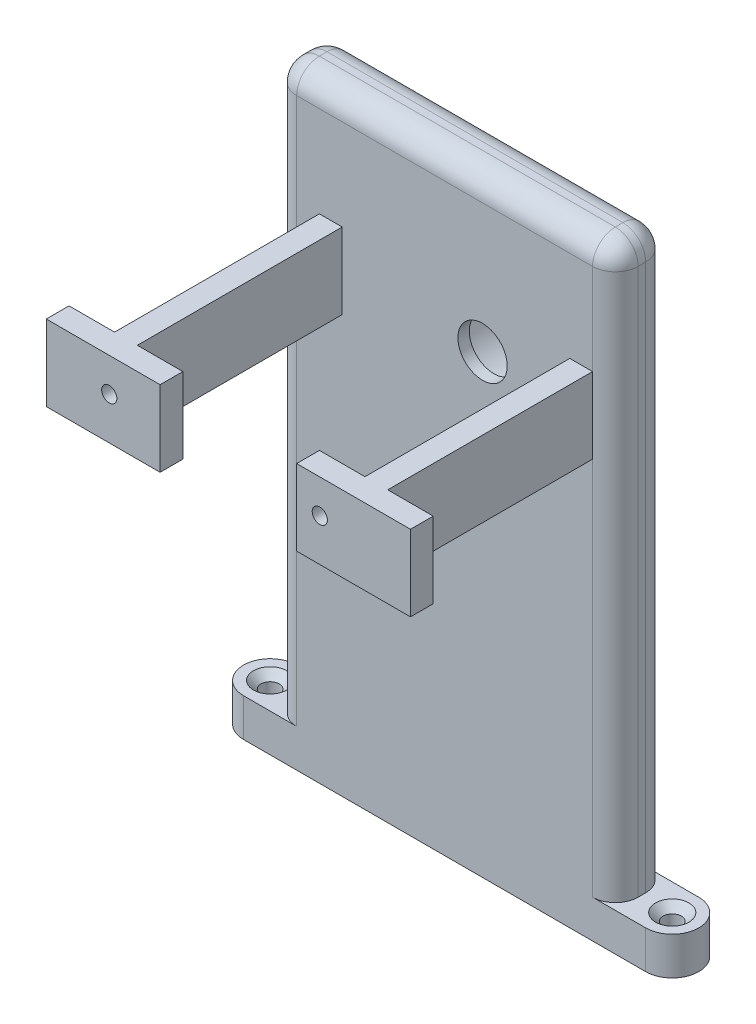
from build123d import *

# Parameters (mm, degrees)
CROQUIS1_W                   = 45
CROQUIS1_H                   = 80
CROQUIS1_R                   = 3.25
SALIENTE_EXTRUIR1_DEPTH      = 7
CROQUIS2_R                   = 6.5
CORTAR_EXTRUIR1_DEPTH        = 5
CROQUIS3_R                   = 6
CORTAR_EXTRUIR2_DEPTH        = 0.5
REDONDEO2_R                  = 3
SALIENTE_EXTRUIR2_DEPTH      = 5
TALADROAVANZADO1_OUTLINE_R   = 1.2
TALADROAVANZADO1_DEPTH       = 1
TALADROAVANZADO1_DRAFT       = -45
TALADROAVANZADO1_2_OUTLINE_R = 1.2
TALADROAVANZADO1_2_DEPTH     = 1
TALADROAVANZADO1_2_DRAFT     = -45
CROQUIS8_R                   = 1.2
CORTAR_EXTRUIR3_DEPTH        = 83.006097334
CROQUIS9_W                   = 3
CROQUIS9_H                   = 10
CROQUIS9_R                   = 1
SALIENTE_EXTRUIR3_DEPTH      = 30
CROQUIS10_W                  = 15
CROQUIS10_H                  = 10
SALIENTE_EXTRUIR4_DEPTH      = 3
CROQUIS11_R                  = 1
CORTAR_EXTRUIR5_DEPTH        = 2


# Read off the part's stored shape, not the designer's step: TaladroAvanzado1
with BuildPart() as part:
    # Croquis1 → Saliente-Extruir1 (new body)
    with BuildSketch(Plane.XY):
        Rectangle(CROQUIS1_W, CROQUIS1_H)
        with Locations((5, 20)):
            Circle(CROQUIS1_R, mode=Mode.SUBTRACT)
    extrude(amount=SALIENTE_EXTRUIR1_DEPTH)

    # Croquis2 → Cortar-Extruir1 (cut)
    with BuildSketch(Plane(origin=(0, 0, 0), x_dir=(-1, 0, 0), z_dir=(0, 0, -1))):
        with Locations((-5, 20)):
            Circle(CROQUIS2_R)
    extrude(amount=-CORTAR_EXTRUIR1_DEPTH, mode=Mode.SUBTRACT)

    # Croquis3 → Cortar-Extruir2 (cut)
    with BuildSketch(Plane(origin=(0, 0, 5), x_dir=(-1, 0, 0), z_dir=(0, 0, -1))):
        with Locations((-5, 20)):
            Circle(CROQUIS3_R)
    extrude(amount=-CORTAR_EXTRUIR2_DEPTH, mode=Mode.SUBTRACT)

    # Redondeo2
    redondeo2_edges = [part.edges().sort_by_distance(p)[0] for p in [
        (-22.5, 40, 3.5),
        (22.5, 40, 3.5),
        (22.5, 0, 7),
        (0, 40, 7),
        (-22.5, 0, 7),
        (-22.5, 0, 0),
        (0, 40, 0),
        (22.5, 0, 0),
    ]]
    fillet(redondeo2_edges, radius=REDONDEO2_R)

    # Croquis4 → Saliente-Extruir2 (add)
    with BuildSketch(Plane.XZ.offset(40)):
        with BuildLine():
            Line((-19.5, 7), (-26.5, 7))
            ThreePointArc((-26.5, 7), (-30, 3.5), (-26.5, 0))
            Line((-26.5, 0), (-19.5, 0))
            Line((-19.5, 0), (-19.5, 7))
        make_face()
        with BuildLine():
            Line((19.5, 7), (26.5, 7))
            ThreePointArc((26.5, 7), (30, 3.5), (26.5, 0))
            Line((26.5, 0), (19.5, 0))
            Line((19.5, 0), (19.5, 7))
        make_face()
    extrude(amount=-SALIENTE_EXTRUIR2_DEPTH)


with BuildPart() as taladroavanzado1_tool:
    # TaladroAvanzado1 outline → TaladroAvanzado1 (with draft: the straight prism first)
    with BuildSketch(Plane(origin=(0, -36, 0), x_dir=(1, 0, 0), z_dir=(0, 1, 0))):
        with Locations((26.5, -3.5)):
            Circle(TALADROAVANZADO1_OUTLINE_R)
    extrude(amount=TALADROAVANZADO1_DEPTH)
    # TaladroAvanzado1: the draft: its side faces are tilted about the plane it starts from
    taladroavanzado1_sides = [taladroavanzado1_tool.faces().sort_by_distance(p)[0] for p in [
        (25.3, -35.5, 3.5),
    ]]
    draft(taladroavanzado1_sides, Plane(origin=(0, -36, 0), x_dir=(1, 0, 0), z_dir=(0, 1, 0)), TALADROAVANZADO1_DRAFT)


with BuildPart() as part_1:
    add(part.part)

    # TaladroAvanzado1: cut by taladroavanzado1_tool
    add(taladroavanzado1_tool.part, mode=Mode.SUBTRACT)


with BuildPart() as taladroavanzado1_2_tool:
    # TaladroAvanzado1 2 outline → TaladroAvanzado1 2 (with draft: the straight prism first)
    with BuildSketch(Plane(origin=(0, -36, 0), x_dir=(1, 0, 0), z_dir=(0, 1, 0))):
        with Locations((-26.5, -3.5)):
            Circle(TALADROAVANZADO1_2_OUTLINE_R)
    extrude(amount=TALADROAVANZADO1_2_DEPTH)
    # TaladroAvanzado1 2: the draft: its side faces are tilted about the plane it starts from
    taladroavanzado1_2_sides = [taladroavanzado1_2_tool.faces().sort_by_distance(p)[0] for p in [
        (-27.7, -35.5, 3.5),
    ]]
    draft(taladroavanzado1_2_sides, Plane(origin=(0, -36, 0), x_dir=(1, 0, 0), z_dir=(0, 1, 0)), TALADROAVANZADO1_2_DRAFT)


with BuildPart() as part_2:
    add(part_1.part)

    # TaladroAvanzado1 2: cut by taladroavanzado1_2_tool
    add(taladroavanzado1_2_tool.part, mode=Mode.SUBTRACT)

    # Croquis8 → Cortar-Extruir3 (cut, through all)
    with BuildSketch(Plane(origin=(0, -36, 0), x_dir=(1, 0, 0), z_dir=(0, 1, 0))):
        with Locations(Location((26.5, -3.5, 0), (0, 0, 270))):
            Circle(CROQUIS8_R)
        with Locations(Location((-26.5, -3.5, 0), (0, 0, 270))):
            Circle(CROQUIS8_R)
    extrude(amount=-CORTAR_EXTRUIR3_DEPTH, mode=Mode.SUBTRACT)

    # Croquis9 → Saliente-Extruir3 (add)
    # profile 1 of 2: a face of its own
    with BuildSketch(Plane.XY.offset(7)):
        with Locations((-15, 20)):
            Rectangle(CROQUIS9_W, CROQUIS9_H)
    # profile 2 of 2: a face of its own
    with BuildSketch(Plane.XY.offset(7)):
        with Locations((18, 20)):
            Rectangle(CROQUIS9_W, CROQUIS9_H)
        with Locations((18, 20)):
            Circle(CROQUIS9_R, mode=Mode.SUBTRACT)
    extrude(amount=SALIENTE_EXTRUIR3_DEPTH)

    # Croquis10 → Saliente-Extruir4 (add)
    with BuildSketch(Plane.XY.offset(37)):
        with Locations((-15, 20)):
            Rectangle(CROQUIS10_W, CROQUIS10_H)
        with Locations((18, 20)):
            Rectangle(CROQUIS10_W, CROQUIS10_H)
    extrude(amount=-SALIENTE_EXTRUIR4_DEPTH)

    # Croquis11 → Cortar-Extruir5 (cut)
    with BuildSketch(Plane.XY.offset(37)):
        with Locations((-14.2, 20.567687828)):
            Circle(CROQUIS11_R)
        with Locations((13.55, 20.567687828)):
            Circle(CROQUIS11_R)
    extrude(amount=-CORTAR_EXTRUIR5_DEPTH, mode=Mode.SUBTRACT)


solid = part_2.part
